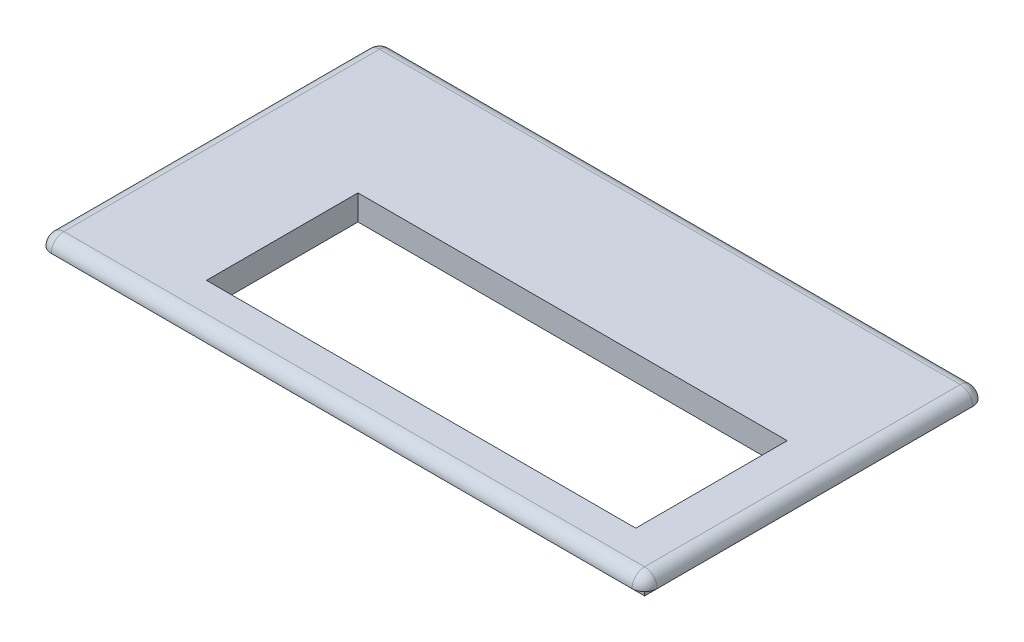
from build123d import *

# Parameters (mm, degrees)
SKETCH_1_W          = 46
SKETCH_1_H          = 25
EXTRUDE_1_DEPTH     = 1
SKETCH_2_W          = 48
SKETCH_2_H          = 27
EXTRUDE_2_DEPTH     = 1
FILLET_1_R          = 1
SKETCH_3_W          = 34
SKETCH_3_H          = 12
CUT_EXTRUDE_2_DEPTH = 2


with BuildPart() as part:
    # ｽｹｯﾁ1 → ﾎﾞｽ - 押し出し1 (new body)
    with BuildSketch(Plane(origin=(0, 0, 0), x_dir=(1, 0, 0), z_dir=(0, 1, 0))):
        with Locations((-2.865663922, 0.615345108)):
            Rectangle(SKETCH_1_W, SKETCH_1_H)
    extrude(amount=EXTRUDE_1_DEPTH)

    # ｽｹｯﾁ2 → ﾎﾞｽ - 押し出し2 (add)
    with BuildSketch(Plane(origin=(0, 1, 0), x_dir=(1, 0, 0), z_dir=(0, 1, 0))):
        with Locations((-2.865663922, 0.615345108)):
            Rectangle(SKETCH_2_W, SKETCH_2_H)
    extrude(amount=EXTRUDE_2_DEPTH)

    # ﾌｨﾚｯﾄ1
    fillet_1_edges = [part.edges().sort_by_distance(p)[0] for p in [
        (-26.865663922, 1.5, -14.115345108),
        (-26.865663922, 1.5, 12.884654892),
        (21.134336078, 1.5, 12.884654892),
        (21.134336078, 1.5, -14.115345108),
        (-26.865663922, 2, -0.615345108),
        (-2.865663922, 2, 12.884654892),
        (21.134336078, 2, -0.615345108),
        (-2.865663922, 2, -14.115345108),
    ]]
    fillet(fillet_1_edges, radius=FILLET_1_R - 0.0001)  # a hair under: the kernel refuses the full size

    # ｽｹｯﾁ3 → ｶｯﾄ - 押し出し2 (cut)
    with BuildSketch(Plane(origin=(0, 2, 0), x_dir=(1, 0, 0), z_dir=(0, 1, 0))):
        with Locations((0.134336078, -3.584654892)):
            Rectangle(SKETCH_3_W, SKETCH_3_H)
    extrude(amount=-CUT_EXTRUDE_2_DEPTH, mode=Mode.SUBTRACT)


solid = part.part
